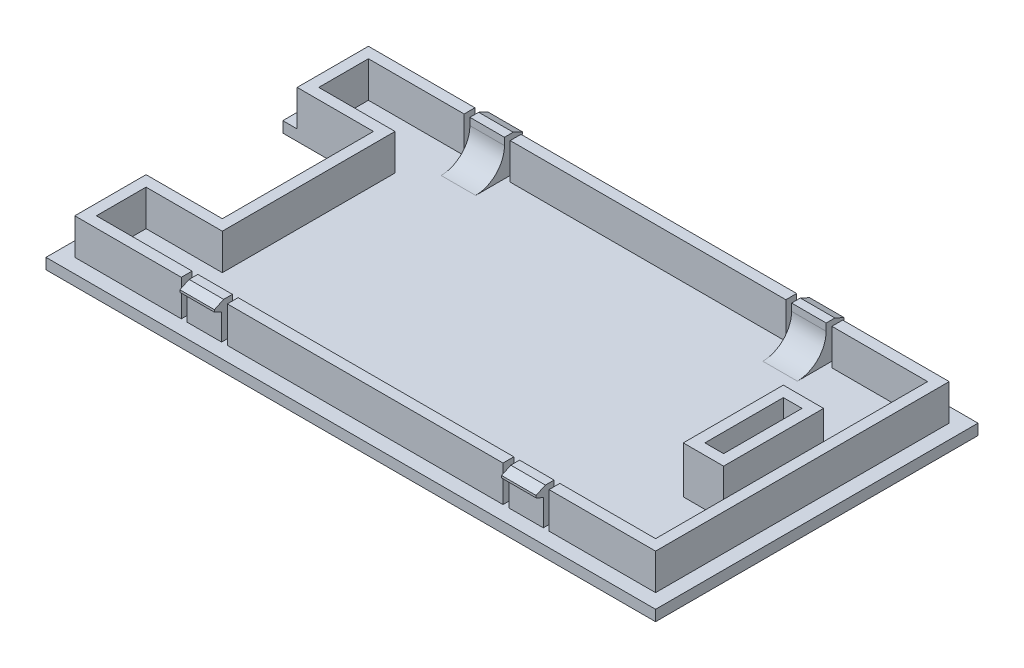
from build123d import *

# Parameters (mm, degrees)
BOSS_EXTRUDE1_DEPTH = 2
BOSS_EXTRUDE2_DEPTH = 5
SKETCH3_W           = 0.8
SKETCH3_H           = 1.5
CUT_EXTRUDE1_DEPTH  = 5
SKETCH4_W           = 4.8
SKETCH4_H           = 1.5
BOSS_EXTRUDE3_DEPTH = 1
CHAMFER3_SIZE       = 0.6
CHAMFER3_SIZE_2     = 1.286704152
SKETCH6_W           = 2.6
SKETCH6_H           = 10.9
CUT_EXTRUDE2_DEPTH  = 49.169310769
SKETCH7_W           = 5.6
SKETCH7_H           = 13.9
SKETCH7_W_2         = 2.6
SKETCH7_H_2         = 10.9
BOSS_EXTRUDE4_DEPTH = 6.5
CHAMFER6_SIZE       = 0.5
FILLET1_R           = 4


with BuildPart() as part:
    # Sketch1 → Boss-Extrude1 (new body)
    with BuildSketch(Plane(origin=(0, 0, 0), x_dir=(1, 0, 0), z_dir=(0, 1, 0))):
        Polygon((-42.35, 10.5), (-29.75, 10.5), (-29.75, -10.5), (-42.35, -10.5), (-42.35, -22.4), (42.35, -22.4), (42.35, 22.4), (-42.35, 22.4), align=None)
    extrude(amount=BOSS_EXTRUDE1_DEPTH)

    # Sketch2 → Boss-Extrude2 (add)
    with BuildSketch(Plane(origin=(0, 2, 0), x_dir=(1, 0, 0), z_dir=(0, 1, 0))):
        Polygon((-40.35, 20.4), (-40.35, 10.5), (-29.75, 10.5), (-29.75, -10.5), (-40.35, -10.5), (-40.35, -20.4), (40.35, -20.4), (40.35, 20.4), align=None)
        Polygon((-38.85, -12), (-38.85, -18.9), (38.85, -18.9), (38.85, 18.9), (-38.85, 18.9), (-38.85, 12), (-28.25, 12), (-28.25, -12), align=None, mode=Mode.SUBTRACT)
    extrude(amount=BOSS_EXTRUDE2_DEPTH)

    # Sketch3 → Cut-Extrude1 (cut)
    with BuildSketch(Plane(origin=(0, 7, 0), x_dir=(1, 0, 0), z_dir=(0, 1, 0))):
        with Locations((-25.15, 19.65)):
            Rectangle(SKETCH3_W, SKETCH3_H)
        with Locations((-19.55, 19.65)):
            Rectangle(SKETCH3_W, SKETCH3_H)
        with Locations((-19.55, -19.65)):
            Rectangle(SKETCH3_W, SKETCH3_H)
        with Locations((-25.15, -19.65)):
            Rectangle(SKETCH3_W, SKETCH3_H)
        with Locations((19.55, 19.65)):
            Rectangle(SKETCH3_W, SKETCH3_H)
        with Locations((25.15, 19.65)):
            Rectangle(SKETCH3_W, SKETCH3_H)
        with Locations((25.15, -19.65)):
            Rectangle(SKETCH3_W, SKETCH3_H)
        with Locations((19.55, -19.65)):
            Rectangle(SKETCH3_W, SKETCH3_H)
    extrude(amount=-CUT_EXTRUDE1_DEPTH, mode=Mode.SUBTRACT)

    # Sketch4 → Boss-Extrude3 (add)
    with BuildSketch(Plane.XY.offset(20.4)):
        with Locations((-22.35, 6.25)):
            Rectangle(SKETCH4_W, SKETCH4_H)
        with Locations((22.35, 6.25)):
            Rectangle(SKETCH4_W, SKETCH4_H)
    boss_extrude3 = extrude(amount=BOSS_EXTRUDE3_DEPTH)

    # Mirror1: Boss-Extrude3 across plane
    add(boss_extrude3.mirror(Plane.XY))

    # Chamfer3
    # the kernel refuses this chamfer: 1.286704152, 0.6 mm, written as the material it takes off along each edge
    with BuildSketch(Plane(origin=(16.616181102, 5.5, -21.4), x_dir=(0, 0.9971975577536771, -0.07481330637060246), z_dir=(1, 0, 0))) as chamfer3_piece_1_section:
        Polygon((CHAMFER3_SIZE * 0.997197557754, CHAMFER3_SIZE * 0.0748133063706), (-CHAMFER3_SIZE_2 * 0.0748133063884, CHAMFER3_SIZE_2 * 0.997197557991), (0, 0), align=None)
    chamfer3_piece_1 = extrude(amount=11.467637795, mode=Mode.PRIVATE)
    chamfer3_piece_1 = split(chamfer3_piece_1, bisect_by=Plane(origin=(22.35, 5.708120407, -20.4), z_dir=(0, 0, -1)), keep=Keep.TOP, mode=Mode.PRIVATE)
    add(chamfer3_piece_1, mode=Mode.SUBTRACT)
    with BuildSketch(Plane(origin=(28.083818898, 7, -21.4), x_dir=(0, 0.016311164131109942, 0.9998669641130704), z_dir=(-1, 0, 0))) as chamfer3_piece_2_section:
        Polygon((CHAMFER3_SIZE_2 * 0.999866964351, -CHAMFER3_SIZE_2 * 0.016311164135), (-CHAMFER3_SIZE * 0.0163111641311, -CHAMFER3_SIZE * 0.999866964113), (0, 0), align=None)
    chamfer3_piece_2 = extrude(amount=8.133818898, mode=Mode.PRIVATE)
    chamfer3_piece_2 = split(chamfer3_piece_2, bisect_by=Plane(origin=(25.55, 6.955435886, -20.304431949), z_dir=(-1, 0, 0)), keep=Keep.TOP, mode=Mode.PRIVATE)
    add(chamfer3_piece_2, mode=Mode.SUBTRACT)
    with BuildSketch(Plane(origin=(-16.616181102, 5.5, -21.4), x_dir=(0, 0.9971975577536771, -0.07481330637060246), z_dir=(-1, 0, 0))) as chamfer3_piece_3_section:
        Polygon((CHAMFER3_SIZE * 0.997197557754, -CHAMFER3_SIZE * 0.0748133063706), (-CHAMFER3_SIZE_2 * 0.0748133063884, -CHAMFER3_SIZE_2 * 0.997197557991), (0, 0), align=None)
    chamfer3_piece_3 = extrude(amount=11.467637795, mode=Mode.PRIVATE)
    chamfer3_piece_3 = split(chamfer3_piece_3, bisect_by=Plane(origin=(-22.35, 5.708120407, -20.4), z_dir=(0, 0, -1)), keep=Keep.TOP, mode=Mode.PRIVATE)
    add(chamfer3_piece_3, mode=Mode.SUBTRACT)
    with BuildSketch(Plane(origin=(-24.75, 7, -21.4), x_dir=(0, 0.016311164131109942, 0.9998669641130704), z_dir=(1, 0, 0))) as chamfer3_piece_4_section:
        Polygon((CHAMFER3_SIZE_2 * 0.999866964351, CHAMFER3_SIZE_2 * 0.016311164135), (-CHAMFER3_SIZE * 0.0163111641311, CHAMFER3_SIZE * 0.999866964113), (0, 0), align=None)
    chamfer3_piece_4 = extrude(amount=8.133818898, mode=Mode.PRIVATE)
    chamfer3_piece_4 = split(chamfer3_piece_4, bisect_by=Plane(origin=(-19.15, 6.955435886, -20.304431949), z_dir=(-1, 0, 0)), keep=Keep.TOP, mode=Mode.PRIVATE)
    add(chamfer3_piece_4, mode=Mode.SUBTRACT)
    with BuildSketch(Plane(origin=(16.616181102, 5.5, 21.4), x_dir=(0, 0.9971975577536771, 0.07481330637060246), z_dir=(1, 0, 0))) as chamfer3_piece_5_section:
        Polygon((CHAMFER3_SIZE * 0.997197557754, -CHAMFER3_SIZE * 0.0748133063706), (-CHAMFER3_SIZE_2 * 0.0748133063884, -CHAMFER3_SIZE_2 * 0.997197557991), (0, 0), align=None)
    chamfer3_piece_5 = extrude(amount=11.467637795, mode=Mode.PRIVATE)
    chamfer3_piece_5 = split(chamfer3_piece_5, bisect_by=Plane(origin=(22.35, 5.708120407, 20.4), z_dir=(0, 0, 1)), keep=Keep.TOP, mode=Mode.PRIVATE)
    add(chamfer3_piece_5, mode=Mode.SUBTRACT)
    with BuildSketch(Plane(origin=(24.75, 7, 21.4), x_dir=(0, 0.016311164131109942, -0.9998669641130704), z_dir=(-1, 0, 0))) as chamfer3_piece_6_section:
        Polygon((CHAMFER3_SIZE_2 * 0.999866964351, CHAMFER3_SIZE_2 * 0.016311164135), (-CHAMFER3_SIZE * 0.0163111641311, CHAMFER3_SIZE * 0.999866964113), (0, 0), align=None)
    chamfer3_piece_6 = extrude(amount=8.133818898, mode=Mode.PRIVATE)
    chamfer3_piece_6 = split(chamfer3_piece_6, bisect_by=Plane(origin=(19.15, 6.955435886, 20.304431949), z_dir=(1, 0, 0)), keep=Keep.TOP, mode=Mode.PRIVATE)
    add(chamfer3_piece_6, mode=Mode.SUBTRACT)
    with BuildSketch(Plane(origin=(-24.75, 7, 21.4), x_dir=(0, 0.016311164131109942, -0.9998669641130704), z_dir=(1, 0, 0))) as chamfer3_piece_7:
        Polygon((CHAMFER3_SIZE_2 * 0.999866964351, -CHAMFER3_SIZE_2 * 0.016311164135), (-CHAMFER3_SIZE * 0.0163111641311, -CHAMFER3_SIZE * 0.999866964113), (0, 0), align=None)
    extrude(amount=4.8, mode=Mode.SUBTRACT)
    with BuildSketch(Plane(origin=(-16.616181102, 5.5, 21.4), x_dir=(0, 0.9971975577536771, 0.07481330637060246), z_dir=(-1, 0, 0))) as chamfer3_piece_8_section:
        Polygon((CHAMFER3_SIZE * 0.997197557754, CHAMFER3_SIZE * 0.0748133063706), (-CHAMFER3_SIZE_2 * 0.0748133063884, CHAMFER3_SIZE_2 * 0.997197557991), (0, 0), align=None)
    chamfer3_piece_8 = extrude(amount=11.467637795, mode=Mode.PRIVATE)
    chamfer3_piece_8 = split(chamfer3_piece_8, bisect_by=Plane(origin=(-22.35, 5.708120407, 20.4), z_dir=(0, 0, 1)), keep=Keep.TOP, mode=Mode.PRIVATE)
    add(chamfer3_piece_8, mode=Mode.SUBTRACT)

    # Sketch6 → Cut-Extrude2 (cut, through all)
    with BuildSketch(Plane(origin=(0, 2, 0), x_dir=(1, 0, 0), z_dir=(0, 1, 0))):
        with Locations((33.55, 0)):
            Rectangle(SKETCH6_W, SKETCH6_H)
    extrude(amount=-CUT_EXTRUDE2_DEPTH, mode=Mode.SUBTRACT)

    # Sketch7 → Boss-Extrude4 (add)
    with BuildSketch(Plane(origin=(0, 2, 0), x_dir=(1, 0, 0), z_dir=(0, 1, 0))):
        with Locations((33.55, 0)):
            Rectangle(SKETCH7_W, SKETCH7_H)
        with Locations((33.55, 0)):
            Rectangle(SKETCH7_W_2, SKETCH7_H_2, mode=Mode.SUBTRACT)
    extrude(amount=BOSS_EXTRUDE4_DEPTH)

    # Chamfer6
    chamfer6_edges = [part.edges().sort_by_distance(p)[0] for p in [
        (-36.05, 0, -10.5),
        (-42.35, 0, -16.45),
        (0, 0, -22.4),
        (42.35, 0, 0),
        (0, 0, 22.4),
        (-42.35, 0, 16.45),
        (-36.05, 0, 10.5),
        (-29.75, 0, 0),
    ]]
    chamfer(chamfer6_edges, length=CHAMFER6_SIZE)

    # Fillet1
    fillet1_edges = [part.edges().sort_by_distance(p)[0] for p in [
        (-22.35, 2, 18.9),
        (22.35, 2, 18.9),
        (22.35, 2, -18.9),
        (-22.35, 2, -18.9),
    ]]
    fillet(fillet1_edges, radius=FILLET1_R)


solid = part.part
